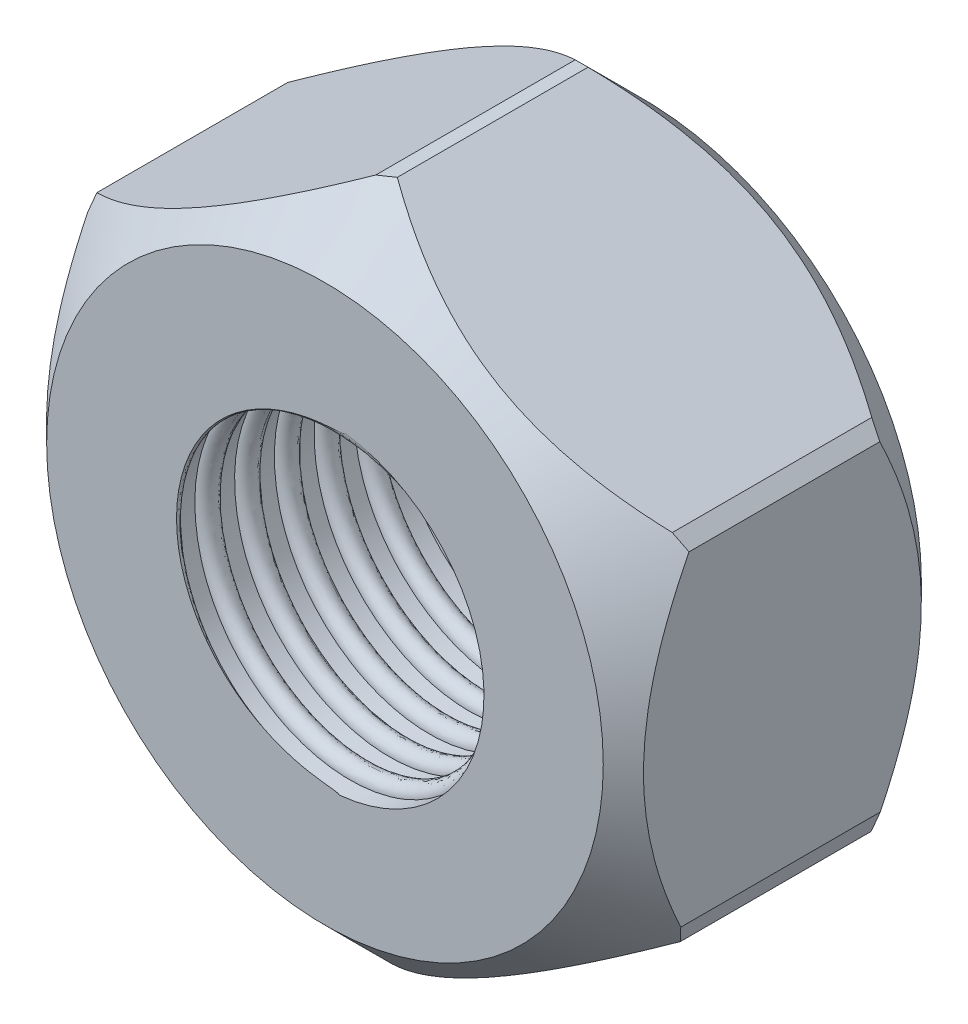
from build123d import *

# Parameters (mm, degrees)
BOSS_EXTRUDE1_DEPTH        = 6
SKETCH2_R                  = 6
BOSS_EXTRUDE2_DEPTH        = 80
SKETCH3_OUTSIDE_W          = 100.562
SKETCH3_OUTSIDE_H          = 103.306
SKETCH3_OUTSIDE_R          = 8
CUT_EXTRUDE1_DEPTH         = 30
CUT_EXTRUDE1_DRAFT         = -45
CHAMFER3_SIZE              = 1
CHAMFER4_SIZE              = 1
CUT_SWEEP1_PITCH           = 1.5
LAB1_NUT_BASIC_START       = 38.89741667
LAB1_NUT_BASIC_OUTLINE_R   = 3
LAB1_NUT_BASIC_DEPTH       = 7.195802227
LAB1_NUT_BASIC_START_2     = 36.495319608
LAB1_NUT_BASIC_2_OUTLINE_R = 3
LAB1_NUT_BASIC_2_DEPTH     = 12


with BuildPart() as part:
    # Sketch1 → Boss-Extrude1 (new, symmetric)
    with BuildSketch(Plane.XY):
        Polygon((9.627937505, -5.323923069), (9.424621378, 5.676076931), (-0.203316127, 11), (-9.627937505, 5.323923069), (-9.424621378, -5.676076931), (0.203316127, -11), align=None)
    extrude(amount=BOSS_EXTRUDE1_DEPTH, both=True)

    # Sketch2 → Boss-Extrude2 (add)
    with BuildSketch(Plane.XY.offset(6)):
        Circle(SKETCH2_R)
    extrude(amount=BOSS_EXTRUDE2_DEPTH)


with BuildPart() as cut_extrude1_tool:
    # Sketch3 outside → Cut-Extrude1 (with draft: the straight prism first)
    with BuildSketch(Plane(origin=(0, 0, -6), x_dir=(-1, 0, 0), z_dir=(0, 0, -1))):
        Rectangle(SKETCH3_OUTSIDE_W, SKETCH3_OUTSIDE_H)
        Circle(SKETCH3_OUTSIDE_R, mode=Mode.SUBTRACT)
    extrude(amount=-CUT_EXTRUDE1_DEPTH)
    # Cut-Extrude1: the draft: its side faces are tilted about the plane it starts from
    cut_extrude1_sides = [cut_extrude1_tool.faces().sort_by_distance(p)[0] for p in [
        (0, -51.653, 9),
        (-50.281, 0, 9),
        (0, 51.653, 9),
        (50.281, 0, 9),
        (8, 0, 9),
    ]]
    draft(cut_extrude1_sides, Plane(origin=(0, 0, -6), x_dir=(-1, 0, 0), z_dir=(0, 0, -1)), CUT_EXTRUDE1_DRAFT)


with BuildPart() as part_1:
    add(part.part)

    # Cut-Extrude1: cut by cut_extrude1_tool
    add(cut_extrude1_tool.part, mode=Mode.SUBTRACT)

    # Chamfer3
    chamfer3_edges = [part_1.edges().sort_by_distance(p)[0] for p in [
        (4.610652626, 8.338038465, 6),
        (-4.915626816, 8.161961535, 6),
        (-9.526279442, -0.176076931, 6),
        (-4.610652626, -8.338038465, 6),
        (4.915626816, -8.161961535, 6),
        (9.526279442, 0.176076931, 6),
    ]]
    chamfer(chamfer3_edges, length=CHAMFER3_SIZE)

    # Chamfer4
    chamfer4_edges = [part_1.edges().sort_by_distance(p)[0] for p in [
        (-6, 0, 86),
    ]]
    chamfer(chamfer4_edges, length=CHAMFER4_SIZE)

    # Cut-Sweep1: arcs per turn and ends read off the stored shape
    # Cut-Sweep1: the profile of Sketch5 screwed along a right-hand helix through 45 turns, 8 arcs to a turn; built about Z, then put on its axis
    cut_sweep1_z = Axis((0, 0, 0), (0, 0, 1))
    cut_sweep1_corners = [(5.6, 0, 0), (6, 0, 0.4), (6.4, 0, 0), (6, 0, -0.4)]
    with BuildLine(mode=Mode.PRIVATE) as cut_sweep1_profile:
        ThreePointArc((5.6, 0, 0), (5.717157288, 0, 0.282842712), (6, 0, 0.4))
        ThreePointArc((6, 0, 0.4), (6.282842712, 0, 0.282842712), (6.4, 0, 0))
        ThreePointArc((6.4, 0, 0), (6.282842712, 0, -0.282842712), (6, 0, -0.4))
        ThreePointArc((6, 0, -0.4), (5.717157288, 0, -0.282842712), (5.6, 0, 0))
    cut_sweep1_cap = Face(cut_sweep1_profile.wire())
    cut_sweep1_arcs = [((5.6, 0, 0), (5.6, 0, 0.4), (6, 0, 0.4), (1, 0.7071067811865476, 1)), ((6, 0, 0.4), (6.4, 0, 0.4), (6.4, 0, 0), (1, 0.7071067811865476, 1)), ((6.4, 0, 0), (6.4, 0, -0.4), (6, 0, -0.4), (1, 0.7071067811865476, 1)), ((6, 0, -0.4), (5.6, 0, -0.4), (5.6, 0, 0), (1, 0.7071067811865476, 1))]  # start, shoulder, end, weights
    cut_sweep1_turn_angles = [0, 22.5, 45, 67.5, 90, 112.5, 135, 157.5, 180, 202.5, 225, 247.5, 270, 292.5, 315, 337.5, 360]
    cut_sweep1_turn_weights = [1, 0.9238795325112867, 1, 0.9238795325112867, 1, 0.9238795325112867, 1, 0.9238795325112867, 1, 0.9238795325112867, 1, 0.9238795325112867, 1, 0.9238795325112867, 1, 0.9238795325112867, 1]
    cut_sweep1_turn_sides = [Face.make_bezier_surface([[Vector(p[j][0], p[j][1], 0).rotate(cut_sweep1_z, cut_sweep1_turn_angles[2 * i + k]) / cut_sweep1_turn_weights[2 * i + k] + Vector(0, 0, p[j][2] + CUT_SWEEP1_PITCH * cut_sweep1_turn_angles[2 * i + k] / 360) for k in range(3)] for j in range(3)], [[p[3][j] * cut_sweep1_turn_weights[2 * i + k] for k in range(3)] for j in range(3)]) for p in cut_sweep1_arcs for i in range(8)]
    cut_sweep1 = Plane(origin=(0, 0, 86), x_dir=(-1, 0, 0), z_dir=(0, 0, -1)) * Solid(Shell([*[p.moved(Location((0, 0, CUT_SWEEP1_PITCH * i))) for i in range(45) for p in cut_sweep1_turn_sides], cut_sweep1_cap, cut_sweep1_cap.rotate(cut_sweep1_z, 16200).moved(Location((0, 0, CUT_SWEEP1_PITCH * 16200 / 360)))]))
    add(cut_sweep1, mode=Mode.SUBTRACT)


with BuildPart() as body_2:
    # Lab1_nut_basic: read off the stored shape, not the designer's step
    # Lab1_nut_basic outline → Lab1_nut_basic (new body)
    with BuildSketch(Plane.XY.offset(LAB1_NUT_BASIC_START)):
        Polygon((0.321171396, -12.732465621), (11.006311942, -6.732385797), (11.187224379, -6.088090222), (11.333573099, 6.165552845), (10.866052983, 6.644375399), (0.327261157, 12.897938642), (-0.321171396, 12.732465621), (-11.006311942, 6.732385797), (-11.187224379, 6.088090222), (-11.333573099, -6.165552845), (-10.866052983, -6.644375399), (-0.327261157, -12.897938642), align=None)
        Circle(LAB1_NUT_BASIC_OUTLINE_R, mode=Mode.SUBTRACT)
    extrude(amount=LAB1_NUT_BASIC_DEPTH)

    # Lab1_nut_basic 2 outline → Lab1_nut_basic 2 (add)
    with BuildSketch(Plane.XY.offset(LAB1_NUT_BASIC_START_2)):
        Polygon((0.321171396, -12.732465621), (11.006311942, -6.732385797), (11.187224379, -6.088090222), (11.333573099, 6.165552845), (10.866052983, 6.644375399), (0.327261157, 12.897938642), (-0.321171396, 12.732465621), (-11.006311942, 6.732385797), (-11.187224379, 6.088090222), (-11.333573099, -6.165552845), (-10.866052983, -6.644375399), (-0.327261157, -12.897938642), align=None)
        Circle(LAB1_NUT_BASIC_2_OUTLINE_R, mode=Mode.SUBTRACT)
    extrude(amount=LAB1_NUT_BASIC_2_DEPTH)

    # Lab1_nut_basic 3 outline → Lab1_nut_basic 3 (revolve, cut)
    with BuildSketch(Plane.XZ):
        Polygon((12.902093913, 48.495319608), (10.5, 48.495319608), (12.902093913, 46.093225695), align=None)
        Polygon((12.902093913, 36.495319608), (12.902093913, 38.897412132), (10.5, 36.495319608), align=None)
    revolve(axis=Axis((0, 0, 0), (0, 0, 1)), mode=Mode.SUBTRACT)

    # Combine2: cut part
    add(part_1.part, mode=Mode.SUBTRACT)


solid = body_2.part
